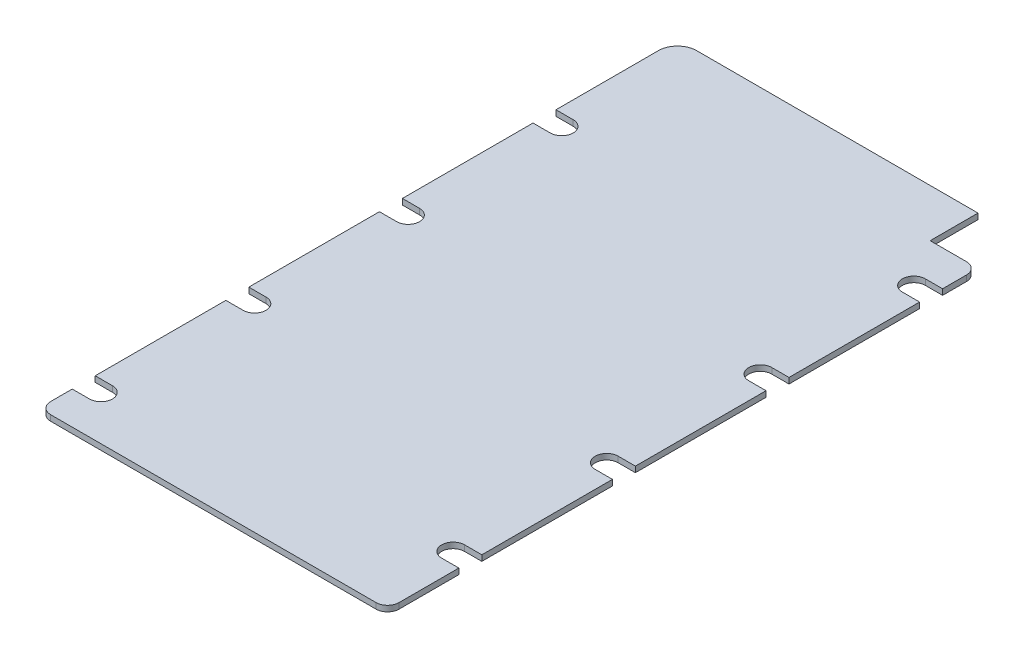
from build123d import *

# Parameters (mm, degrees)
BOSS_EXTRUDE1_DEPTH = 3
FILLET1_R           = 10
FILLET2_R           = 6


with BuildPart() as part:
    # Sketch1 → Boss-Extrude1 (new body)
    with BuildSketch(Plane(origin=(0, 0, 0), x_dir=(1, 0, 0), z_dir=(0, 1, 0))):
        with BuildLine():
            Line((-91, 35.496910853), (-82, 35.496910853))
            ThreePointArc((-82, 35.496910853), (-76, 29.496910853), (-82, 23.496910853))
            Line((-82, 23.496910853), (-91, 23.496910853))
            Line((-91, 23.496910853), (-91, -44.753089147))
            Line((-91, -44.753089147), (-82, -44.753089147))
            ThreePointArc((-82, -44.753089147), (-76, -50.753089147), (-82, -56.753089147))
            Line((-82, -56.753089147), (-91, -56.753089147))
            Line((-91, -56.753089147), (-91, -125.003089147))
            Line((-91, -125.003089147), (-82, -125.003089147))
            ThreePointArc((-82, -125.003089147), (-76, -131.003089147), (-82, -137.003089147))
            Line((-82, -137.003089147), (-91, -137.003089147))
            Line((-91, -137.003089147), (-91, -154.253089147))
            Line((-91, -154.253089147), (91, -154.253089147))
            Line((91, -154.253089147), (91, -117.003089147))
            Line((91, -117.003089147), (82, -117.003089147))
            ThreePointArc((82, -117.003089147), (76, -111.003089147), (82, -105.003089147))
            Line((82, -105.003089147), (91, -105.003089147))
            Line((91, -105.003089147), (91, -36.753089147))
            Line((91, -36.753089147), (82, -36.753089147))
            ThreePointArc((82, -36.753089147), (76, -30.753089147), (82, -24.753089147))
            Line((82, -24.753089147), (91, -24.753089147))
            Line((91, -24.753089147), (91, 43.496910853))
            Line((91, 43.496910853), (82, 43.496910853))
            ThreePointArc((82, 43.496910853), (76, 49.496910853), (82, 55.496910853))
            Line((82, 55.496910853), (91, 55.496910853))
            Line((91, 55.496910853), (91, 123.746910853))
            Line((91, 123.746910853), (82, 123.746910853))
            ThreePointArc((82, 123.746910853), (76, 129.746910853), (82, 135.746910853))
            Line((82, 135.746910853), (91, 135.746910853))
            Line((91, 135.746910853), (91, 154.253089147))
            Line((91, 154.253089147), (66, 154.253089147))
            Line((66, 154.253089147), (66, 179.253089147))
            Line((66, 179.253089147), (-91, 179.253089147))
            Line((-91, 179.253089147), (-91, 115.746910853))
            Line((-91, 115.746910853), (-82, 115.746910853))
            ThreePointArc((-82, 115.746910853), (-76, 109.746910853), (-82, 103.746910853))
            Line((-82, 103.746910853), (-91, 103.746910853))
            Line((-91, 103.746910853), (-91, 35.496910853))
        make_face()
    extrude(amount=BOSS_EXTRUDE1_DEPTH)

    # Fillet1
    fillet1_edges = [part.edges().sort_by_distance(p)[0] for p in [
        (-91, 1.5, -179.253089147),
    ]]
    fillet(fillet1_edges, radius=FILLET1_R)

    # Fillet2
    fillet2_edges = [part.edges().sort_by_distance(p)[0] for p in [
        (91, 1.5, 154.253089147),
        (-91, 1.5, 154.253089147),
        (91, 1.5, -154.253089147),
    ]]
    fillet(fillet2_edges, radius=FILLET2_R)


solid = part.part
